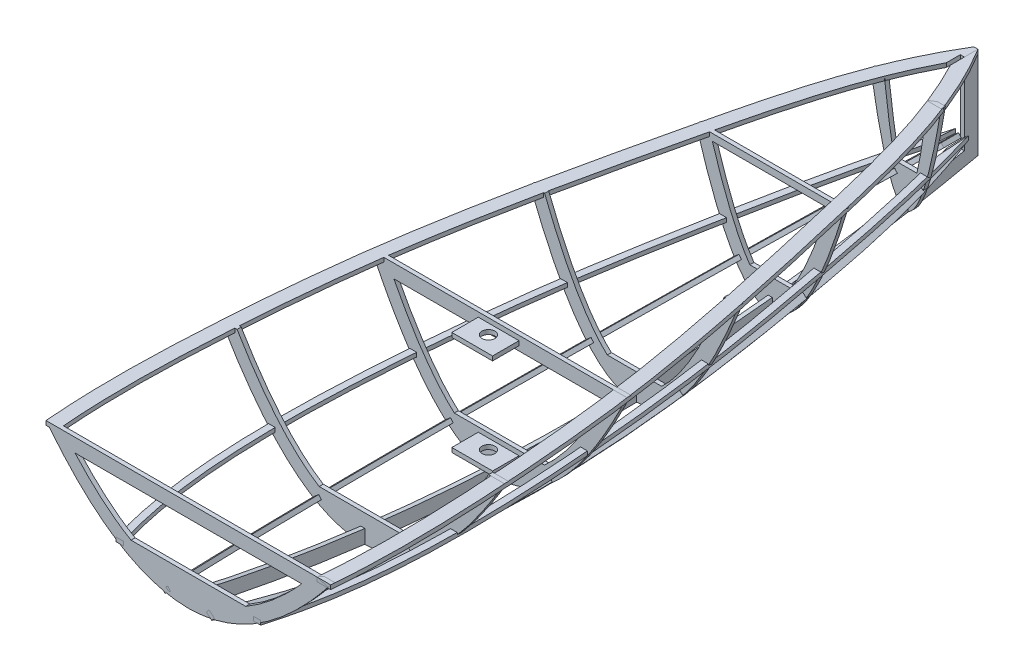
from build123d import *

# Parameters (mm, degrees)
BOSS_EXTRUDE1_DEPTH     = 1.51
BOSS_EXTRUDE2_DEPTH     = 1.51
BOSS_EXTRUDE3_START     = -1.51
BOSS_EXTRUDE3_DEPTH     = 3.02
BOSS_EXTRUDE4_START     = -3.02
BOSS_EXTRUDE4_DEPTH     = 3.02
BOSS_EXTRUDE5_START     = -1.51
BOSS_EXTRUDE5_OUTLINE_W = 30
BOSS_EXTRUDE5_OUTLINE_H = 3.2
BOSS_EXTRUDE5_DEPTH     = 3.02
BOSS_EXTRUDE6_DEPTH     = 1.51
BOSS_EXTRUDE7_DEPTH     = 1.51
BOSS_EXTRUDE8_DEPTH     = 1.51
BOSS_EXTRUDE11_DEPTH    = 1.6
BOSS_EXTRUDE9_DEPTH     = 3.02
SKETCH19_W              = 30
SKETCH19_H              = 22.5
SKETCH19_R              = 4.7625
BOSS_EXTRUDE12_DEPTH    = 3.2
BOSS_EXTRUDE13_START    = -73.370907
SKETCH19_2_W            = 30
SKETCH19_2_H            = 22.5
SKETCH19_2_R            = 4.7625
BOSS_EXTRUDE13_DEPTH    = 3.2


with BuildPart() as part:
    # Sketch12 → Boss-Extrude1 (new, symmetric)
    with BuildSketch(Plane(origin=(0, 0, 0), x_dir=(0, 0, -1), z_dir=(1, 0, 0))):
        with BuildLine():
            Line((-577.712135073, 42.420217283), (-579.999999592, 42.957911139))
            Line((-579.999999592, 42.957911139), (-579.999999592, 32.68545093))
            add(Edge.make_bspline(
                [(0, 32.145901014), (-49.525330781, 21.417396015), (-132.611366978, 7.429683457), (-249.881952902, -0.655976348), (-350.181116019, 0.094338407), (-460.668307849, 9.54780018), (-537.156578471, 22.616391283), (-579.999999592, 32.68545093)],
                knots=[0, 0, 0, 0, 0.260060421, 0.431503634, 0.602543052, 0.77418881, 1, 1, 1, 1], degree=3))
            Line((0, 32.145901014), (0, 42.377846539))
            Line((0, 42.377846539), (0, 100))
            Line((0, 100), (-10, 100))
            Line((-10, 100), (-10, 40.232191823))
            add(Edge.make_bspline(
                [(-10, 40.232191823), (-31.052581694, 35.782071128), (-75.990667051, 27.227393084), (-145.201305909, 17.437334137), (-217.502735798, 11.352979962), (-290.057427903, 9.323515679), (-362.585667071, 11.362235017), (-434.900780043, 17.513411459), (-506.835309141, 27.459676615), (-554.205734661, 36.895743708), (-577.712135073, 42.420217283)],
                knots=[0.013877421, 0.013877421, 0.013877421, 0.013877421, 0.125, 0.25, 0.375, 0.5, 0.625, 0.75, 0.875, 1, 1, 1, 1], degree=3))
        make_face()
    extrude(amount=BOSS_EXTRUDE1_DEPTH, both=True)


with BuildPart() as body_2:
    # Sketch13 → Boss-Extrude2 (new, symmetric)
    with BuildSketch(Plane(origin=(0, 50, 349.999999694), x_dir=(0, 0, -1), z_dir=(0.6427876096865381, 0.7660444431189791, 0))):
        with BuildLine():
            Line((339.743877836, -1.97092204), (327.028680724, -2.207358466))
            add(Edge.make_bspline(
                [(-228.638126642, -18.965520589), (-205.328000422, -25.564091644), (-169.71378297, -33.048286306), (-121.506682722, -39.379688009), (-73.01231088, -43.707584978), (-12.203336667, -45.868404467), (48.636352849, -44.036231472), (97.255668277, -40.66150775), (145.796442696, -36.203035302), (206.192712118, -28.441379937), (266.013860499, -17.275577293), (306.123232335, -7.743192742), (322.472206916, -3.440078745), (327.028680724, -2.207358466)],
                knots=[0, 0, 0, 0, 0.125, 0.1875, 0.25, 0.375, 0.5, 0.5625, 0.625, 0.75, 0.875, 0.9375, 0.961706413, 0.961706413, 0.961706413, 0.961706413], degree=3))
            Line((-228.638126642, -18.965520589), (-229.999999898, -18.580004982))
            Line((-229.999999898, -18.580004982), (-229.999999898, -23.776476963))
            add(Edge.make_bspline(
                [(-229.999999898, -23.776476963), (-187.624946823, -35.810765879), (-110.757346564, -47.307733367), (0.007380653, -52.092222889), (100.344733064, -46.361807952), (200.209241181, -34.219669393), (281.165485841, -22.017381692), (326.582041192, -8.953425301), (339.743877836, -4.478430193)],
                knots=[0, 0, 0, 0, 0.225071004, 0.395640197, 0.566277038, 0.737858903, 0.910958545, 0.981893873, 0.981893873, 0.981893873, 0.981893873], degree=3))
            Line((339.743877836, -4.478430193), (339.743877836, -1.97092204))
        make_face()
    extrude(amount=BOSS_EXTRUDE2_DEPTH, both=True)


with BuildPart() as body_3:
    # Mirror2: mirrored copy
    add(body_2.part.mirror(Plane(origin=(0, 0, 0), x_dir=(0, 0, 1), z_dir=(1, 0, 0))))


with BuildPart() as body_4:
    # Boss-Extrude3: read off the stored shape, not the designer's step
    # Boss-Extrude3 outline → Boss-Extrude3 (new body)
    with BuildSketch(Plane(origin=(0, 50, 0), x_dir=(1, 0, 0), z_dir=(0, 1, 0)).offset(BOSS_EXTRUDE3_START)):
        with BuildLine():
            Line((-47.957215706, -579.999999592), (-48.386027601, -578.56678991))
            add(Edge.make_bspline(
                [(-48.386027601, -578.56678991), (-51.780390578, -567.221947535), (-57.255740987, -544.144931603), (-62.14939856, -508.831952672), (-64.41246603, -473.037439636), (-64.759896634, -437.06816633), (-63.749399228, -401.171318806), (-61.60368121, -365.309028432), (-58.650503305, -329.474788162), (-54.963833585, -293.729962155), (-50.458388492, -258.090690177), (-45.052882293, -222.571282312), (-38.912555662, -187.119022753), (-30.051072715, -139.897301168), (-19.808313073, -88.535773063), (-10.325579957, -49.434915702), (-6.109558895, -33.694313911)],
                knots=[0.018209111, 0.018209111, 0.018209111, 0.018209111, 0.079571041, 0.140932972, 0.202294903, 0.263656833, 0.325018764, 0.386380694, 0.447742625, 0.509104555, 0.570466486, 0.631828417, 0.693190347, 0.754552278, 0.877276139, 0.960875362, 0.960875362, 0.960875362, 0.960875362], degree=3))
            Line((-6.109558895, -33.694313911), (-4.729698326, -10.256121858))
            add(Edge.make_bspline(
                [(-4.729698326, -10.256121858), (-8.59723264, -23.432288644), (-21.03171572, -69.608062913), (-37.295053486, -149.666311038), (-55.346205502, -249.581342159), (-66.234910476, -349.71161378), (-72.032198264, -460.286609496), (-65.753581713, -537.962915804), (-53.176216533, -579.999999592)],
                knots=[0.018209111, 0.018209111, 0.018209111, 0.018209111, 0.088278964, 0.262319454, 0.434981474, 0.606296405, 0.776566769, 1, 1, 1, 1], degree=3))
            Line((-53.176216533, -579.999999592), (-47.957215706, -579.999999592))
        make_face()
    extrude(amount=BOSS_EXTRUDE3_DEPTH)


with BuildPart() as body_5:
    # Mirror3: mirrored copy
    add(body_4.part.mirror(Plane(origin=(0, 0, 0), x_dir=(0, 0, 1), z_dir=(1, 0, 0))))


with BuildPart() as body_6:
    # Boss-Extrude4: read off the stored shape, not the designer's step
    # Boss-Extrude4 outline → Boss-Extrude4 (new body)
    with BuildSketch(Plane(origin=(0, 100, 0), x_dir=(1, 0, 0), z_dir=(0, 1, 0)).offset(BOSS_EXTRUDE4_START)):
        with BuildLine():
            add(Edge.make_bspline(
                [(1.51, 0), (29.584376395, -45.91990858), (50.561731734, -131.537674374), (77.549983497, -249.48960785), (95.891946939, -349.466899638), (105.994111445, -459.74489833), (108.450715428, -536.753852141), (104.849487474, -579.999999592)],
                knots=[0, 0, 0, 0, 0.268699023, 0.441133859, 0.611992394, 0.781089211, 1, 1, 1, 1], degree=3))
            Line((1.51, 0), (1.51, -20.242310976))
            add(Edge.make_bspline(
                [(1.51, -20.242310976), (1.624154147, -20.45928607), (4.52435319, -25.989273244), (12.437759947, -42.379794316), (23.206065428, -70.462042429), (33.548075871, -105.49899509), (40.887847408, -135.419484837), (46.556412593, -159.558389269), (52.169819755, -183.656511356), (58.999093392, -213.74858749), (66.769506371, -249.891743153), (73.974014335, -286.144876799), (80.384277047, -322.497100308), (85.741554413, -358.920589589), (89.905116159, -395.520906247), (93.082025729, -432.287571962), (95.515998483, -469.207045664), (97.044272034, -506.022429463), (97.118154571, -542.712791999), (95.894970795, -567.031140248), (94.883979989, -579.170143842)],
                knots=[0.029973022, 0.029973022, 0.029973022, 0.029973022, 0.03125, 0.0625, 0.125, 0.1875, 0.25, 0.28125, 0.3125, 0.375, 0.4375, 0.5, 0.5625, 0.625, 0.6875, 0.75, 0.8125, 0.875, 0.9375, 1, 1, 1, 1], degree=3))
            Line((94.883979989, -579.170143842), (94.814875574, -579.999999592))
            Line((94.814875574, -579.999999592), (104.849487474, -579.999999592))
        make_face()
    boss_extrude4 = extrude(amount=BOSS_EXTRUDE4_DEPTH)


with BuildPart() as body_7:
    # Boss-Extrude5: read off the stored shape, not the designer's step
    # Boss-Extrude5 outline → Boss-Extrude5 (new body)
    with BuildSketch(Plane.XY.offset(349.999999694).offset(BOSS_EXTRUDE5_START)):
        with BuildLine():
            add(Edge.make_bspline(
                [(-93.277863778, 100), (0.577718303, -97.223102138), (94.433300385, 100)],
                knots=[0.082951726, 0.082951726, 0.082951726, 0.917048274, 0.917048274, 0.917048274], degree=2))
            Line((94.433300385, 100), (-93.277863778, 100))
        make_face()
        with Locations((0, 21.629092809)):
            Rectangle(BOSS_EXTRUDE5_OUTLINE_W, BOSS_EXTRUDE5_OUTLINE_H, mode=Mode.SUBTRACT)
        with BuildLine():
            add(Edge.make_bspline(
                [(-77.172551795, 89.99999997), (-75.488371498, 86.733086903), (-71.765938198, 79.72797637), (-66.026158874, 69.661419231), (-59.962827418, 59.878586103), (-51.936080058, 48.054282871), (-43.737145318, 37.712907061), (-36.690709516, 30.37329819), (-33.564037303, 27.474408803), (-32.616641803, 26.629092809)],
                knots=[0.115020129, 0.115020129, 0.115020129, 0.115020129, 0.137965175, 0.165814007, 0.19366284, 0.221511673, 0.277209338, 0.308992768, 0.322917184, 0.322917184, 0.322917184, 0.322917184], degree=3))
            Line((-77.172551795, 89.99999997), (78.327988402, 89.99999997))
            add(Edge.make_bspline(
                [(33.77207841, 26.629092809), (34.71947391, 27.474408803), (37.846146121, 30.373298189), (44.892581923, 37.712907058), (53.091516662, 48.054282867), (61.118264022, 59.878586098), (67.181595477, 69.661419226), (72.921374803, 79.727976366), (76.643808104, 86.733086901), (78.327988402, 89.99999997)],
                knots=[0.677082816, 0.677082816, 0.677082816, 0.677082816, 0.691007232, 0.722790662, 0.778488327, 0.80633716, 0.834185993, 0.862034825, 0.884979871, 0.884979871, 0.884979871, 0.884979871], degree=3))
            Line((33.77207841, 26.629092809), (-32.616641803, 26.629092809))
        make_face(mode=Mode.SUBTRACT)
        with Locations((0, 95)):
            Rectangle(BOSS_EXTRUDE5_OUTLINE_W, BOSS_EXTRUDE5_OUTLINE_H, mode=Mode.SUBTRACT)
    extrude(amount=BOSS_EXTRUDE5_DEPTH)

    # Sketch19 → Boss-Extrude12 (add)
    with BuildSketch(Plane(origin=(0, 93.4, 0), x_dir=(1, 0, 0), z_dir=(0, 1, 0))):
        with Locations((0, -359.739999694)):
            Rectangle(SKETCH19_W, SKETCH19_H)
        with Locations(Location((0, -359.009999694, 0), (0, 0, 270))):
            Circle(SKETCH19_R, mode=Mode.SUBTRACT)
    extrude(amount=BOSS_EXTRUDE12_DEPTH)

    # Sketch19<2> → Boss-Extrude13 (add)
    with BuildSketch(Plane(origin=(0, 93.4, 0), x_dir=(1, 0, 0), z_dir=(0, 1, 0)).offset(BOSS_EXTRUDE13_START)):
        with Locations((0, -359.739999694)):
            Rectangle(SKETCH19_2_W, SKETCH19_2_H)
        with Locations(Location((0, -359.009999694, 0), (0, 0, 270))):
            Circle(SKETCH19_2_R, mode=Mode.SUBTRACT)
    extrude(amount=BOSS_EXTRUDE13_DEPTH)


with BuildPart() as body_8:
    # Sketch3 → Boss-Extrude6 (new, symmetric)
    with BuildSketch(Plane.XY.offset(249.999999796)):
        with BuildLine():
            Line((-66.164994966, 100), (-76.900421758, 100))
            add(Edge.make_bspline(
                [(-76.900421758, 100), (1e-09, -98.768944841), (76.900421759, 100)],
                knots=[0.153970677, 0.153970677, 0.153970677, 0.846029323, 0.846029323, 0.846029323], degree=2))
            Line((76.900421759, 100), (66.164994967, 100))
            add(Edge.make_bspline(
                [(19.977750638, 20), (20.874930157, 20.803647876), (24.031714806, 23.79470676), (31.075637964, 31.736923077), (41.367334507, 46.838876846), (51.443490399, 65.874869121), (59.58308283, 83.831283466), (63.820493927, 94.069554672), (66.017237824, 99.625197236), (66.164994967, 100)],
                knots=[0.619916665, 0.619916665, 0.619916665, 0.619916665, 0.633981515, 0.668778193, 0.72503759, 0.781296988, 0.809426687, 0.837556386, 0.839584601, 0.839584601, 0.839584601, 0.839584601], degree=3))
            Line((19.977750638, 20), (-19.977750637, 20))
            add(Edge.make_bspline(
                [(-66.164994966, 100), (-66.017237823, 99.625197237), (-63.820493927, 94.069554674), (-59.58308283, 83.831283469), (-51.443490399, 65.874869124), (-41.367334507, 46.838876848), (-31.075637963, 31.736923078), (-24.031714806, 23.794706761), (-20.874930156, 20.803647876), (-19.977750637, 20)],
                knots=[0.160415399, 0.160415399, 0.160415399, 0.160415399, 0.162443614, 0.190573313, 0.218703012, 0.27496241, 0.331221807, 0.366018485, 0.380083335, 0.380083335, 0.380083335, 0.380083335], degree=3))
        make_face()
    extrude(amount=BOSS_EXTRUDE6_DEPTH, both=True)


with BuildPart() as body_9:
    # Sketch2 → Boss-Extrude7 (new, symmetric)
    with BuildSketch(Plane.XY.offset(149.999999898)):
        with BuildLine():
            Line((-44.141104322, 100), (-54.574057855, 100))
            add(Edge.make_bspline(
                [(-54.574057855, 100), (0, -84.930942065), (54.574057856, 100)],
                knots=[0.252174693, 0.252174693, 0.252174693, 0.747825307, 0.747825307, 0.747825307], degree=2))
            Line((54.574057856, 100), (44.141104323, 100))
            add(Edge.make_bspline(
                [(42.620280244, 94.999999998), (43.126908761, 96.641318282), (43.633855992, 98.307997269), (44.141104323, 100)],
                knots=[0.736932967, 0.736932967, 0.736932967, 0.736932967, 0.743946627, 0.743946627, 0.743946627, 0.743946627], degree=3))
            add(Edge.make_bspline(
                [(15.021850494, 30), (15.482688715, 30.665037197), (16.412555161, 32.051495373), (18.826789615, 35.886481746), (22.755228229, 42.901269605), (29.970392448, 58.277568708), (36.273369316, 75.189483004), (41.084126126, 90.073085786), (42.108011639, 93.340409589), (42.620280244, 94.999999998)],
                knots=[0.60554065, 0.60554065, 0.60554065, 0.60554065, 0.61263239, 0.61972413, 0.641834804, 0.670201764, 0.722749487, 0.729841227, 0.736932967, 0.736932967, 0.736932967, 0.736932967], degree=3))
            add(Edge.make_bspline(
                [(-15.021850493, 30), (-14.561012272, 29.334962803), (-13.244589919, 27.499451376), (-10.196217795, 23.67845612), (-6.17905019, 19.852352844), (-3.039104367, 18.127433877), (-1.185298275, 17.607875327), (2e-09, 17.497855788), (1.185298279, 17.607875328), (3.039104372, 18.127433879), (6.179050196, 19.852352848), (10.196217799, 23.678456125), (13.244589922, 27.499451379), (14.561012273, 29.334962803), (15.021850494, 30)],
                knots=[0.39445935, 0.39445935, 0.39445935, 0.39445935, 0.40155109, 0.414899118, 0.443266079, 0.471633039, 0.48581652, 0.5, 0.51418348, 0.528366961, 0.556733921, 0.585100882, 0.59844891, 0.60554065, 0.60554065, 0.60554065, 0.60554065], degree=3))
            add(Edge.make_bspline(
                [(-42.620280243, 94.999999998), (-42.108011638, 93.340409589), (-41.084126125, 90.073085786), (-36.273369313, 75.189482996), (-29.970392442, 58.277568696), (-22.755228223, 42.901269596), (-18.826789612, 35.886481743), (-16.41255516, 32.051495373), (-15.482688714, 30.665037197), (-15.021850493, 30)],
                knots=[0.263067033, 0.263067033, 0.263067033, 0.263067033, 0.270158773, 0.277250513, 0.329798236, 0.358165196, 0.38027587, 0.38736761, 0.39445935, 0.39445935, 0.39445935, 0.39445935], degree=3))
            add(Edge.make_bspline(
                [(-44.141104322, 100), (-43.633855991, 98.307997269), (-43.126908761, 96.641318282), (-42.620280243, 94.999999998)],
                knots=[0.256053373, 0.256053373, 0.256053373, 0.256053373, 0.263067033, 0.263067033, 0.263067033, 0.263067033], degree=3))
        make_face()
        with BuildLine():
            Line((44.141104323, 100), (-44.141104322, 100))
            add(Edge.make_bspline(
                [(-44.141104322, 100), (-43.633855991, 98.307997269), (-43.126908761, 96.641318282), (-42.620280243, 94.999999998)],
                knots=[0.256053373, 0.256053373, 0.256053373, 0.256053373, 0.263067033, 0.263067033, 0.263067033, 0.263067033], degree=3))
            Line((-42.620280243, 94.999999998), (42.620280244, 94.999999998))
            add(Edge.make_bspline(
                [(42.620280244, 94.999999998), (43.126908761, 96.641318282), (43.633855992, 98.307997269), (44.141104323, 100)],
                knots=[0.736932967, 0.736932967, 0.736932967, 0.736932967, 0.743946627, 0.743946627, 0.743946627, 0.743946627], degree=3))
        make_face()
        with BuildLine():
            Line((15.021850494, 30), (-15.021850493, 30))
            add(Edge.make_bspline(
                [(-15.021850493, 30), (-14.561012272, 29.334962803), (-13.244589919, 27.499451376), (-10.196217795, 23.67845612), (-6.17905019, 19.852352844), (-3.039104367, 18.127433877), (-1.185298275, 17.607875327), (2e-09, 17.497855788), (1.185298279, 17.607875328), (3.039104372, 18.127433879), (6.179050196, 19.852352848), (10.196217799, 23.678456125), (13.244589922, 27.499451379), (14.561012273, 29.334962803), (15.021850494, 30)],
                knots=[0.39445935, 0.39445935, 0.39445935, 0.39445935, 0.40155109, 0.414899118, 0.443266079, 0.471633039, 0.48581652, 0.5, 0.51418348, 0.528366961, 0.556733921, 0.585100882, 0.59844891, 0.60554065, 0.60554065, 0.60554065, 0.60554065], degree=3))
        make_face()
    extrude(amount=BOSS_EXTRUDE7_DEPTH, both=True)


with BuildPart() as body_10:
    # Sketch5 → Boss-Extrude8 (new, symmetric)
    with BuildSketch(Plane.XY.offset(449.999999592)):
        with BuildLine():
            Line((-92.635192534, 100), (-104.2281432, 100))
            add(Edge.make_bspline(
                [(-104.2281432, 100), (0, -80.296453814), (104.228143201, 100)],
                knots=[0.080849136, 0.080849136, 0.080849136, 0.919150864, 0.919150864, 0.919150864], degree=2))
            Line((104.228143201, 100), (92.635192535, 100))
            add(Edge.make_bspline(
                [(32.198062586, 30), (33.22805556, 30.64069364), (35.296942023, 31.986417641), (40.619588122, 35.752691583), (49.206844806, 42.826314426), (59.064391632, 52.943653391), (67.837657089, 63.458838359), (74.463600532, 72.156882854), (81.127599779, 81.665959915), (86.707115174, 90.26465744), (90.547630011, 96.512596453), (92.151577539, 99.187511767), (92.635192535, 100)],
                knots=[0.650724667, 0.650724667, 0.650724667, 0.650724667, 0.664556376, 0.678388086, 0.72130735, 0.776634188, 0.804297606, 0.831961025, 0.859624444, 0.887287863, 0.901119572, 0.907086872, 0.907086872, 0.907086872, 0.907086872], degree=3))
            add(Edge.make_bspline(
                [(-32.198062586, 30), (-31.168069612, 29.35930636), (-28.197033065, 27.596385304), (-21.215677113, 24.033549171), (-11.476442878, 20.718171411), (0, 19.418573934), (11.476442878, 20.71817141), (21.215677113, 24.033549171), (28.197033066, 27.596385304), (31.168069613, 29.35930636), (32.198062586, 30)],
                knots=[0.349275333, 0.349275333, 0.349275333, 0.349275333, 0.363107042, 0.389346325, 0.444673162, 0.5, 0.555326837, 0.610653675, 0.636892958, 0.650724667, 0.650724667, 0.650724667, 0.650724667], degree=3))
            add(Edge.make_bspline(
                [(-92.635192534, 100), (-92.151577539, 99.187511768), (-90.547630011, 96.512596455), (-86.707115174, 90.264657442), (-81.12759978, 81.665959917), (-74.463600532, 72.156882855), (-67.83765709, 63.458838361), (-59.064391633, 52.943653392), (-49.206844806, 42.826314426), (-40.619588121, 35.752691584), (-35.296942022, 31.986417641), (-33.228055559, 30.64069364), (-32.198062586, 30)],
                knots=[0.092913128, 0.092913128, 0.092913128, 0.092913128, 0.098880428, 0.112712137, 0.140375556, 0.168038975, 0.195702394, 0.223365812, 0.27869265, 0.321611914, 0.335443624, 0.349275333, 0.349275333, 0.349275333, 0.349275333], degree=3))
        make_face()
        with BuildLine():
            Line((32.198062586, 30), (-32.198062586, 30))
            add(Edge.make_bspline(
                [(-32.198062586, 30), (-31.168069612, 29.35930636), (-28.197033065, 27.596385304), (-21.215677113, 24.033549171), (-11.476442878, 20.718171411), (0, 19.418573934), (11.476442878, 20.71817141), (21.215677113, 24.033549171), (28.197033066, 27.596385304), (31.168069613, 29.35930636), (32.198062586, 30)],
                knots=[0.349275333, 0.349275333, 0.349275333, 0.349275333, 0.363107042, 0.389346325, 0.444673162, 0.5, 0.555326837, 0.610653675, 0.636892958, 0.650724667, 0.650724667, 0.650724667, 0.650724667], degree=3))
        make_face()
    extrude(amount=BOSS_EXTRUDE8_DEPTH, both=True)


with BuildPart() as body_11:
    # Sketch1 → Boss-Extrude11 (new, symmetric)
    with BuildSketch(Plane.XY.offset(50)):
        with BuildLine():
            Line((-25.909294324, 100), (-15.909294324, 100))
            add(Edge.make_bspline(
                [(-15.909294324, 100), (-12.034369694, 66.950295677), (-8.159445002, 50)],
                knots=[0, 0, 0, 0.243563581, 0.243563581, 0.243563581], degree=2))
            Line((-8.159445002, 50), (8.15944517, 50))
            add(Edge.make_bspline(
                [(8.15944517, 50), (12.034369995, 66.950295677), (15.909294882, 100)],
                knots=[0.756436419, 0.756436419, 0.756436419, 1, 1, 1], degree=2))
            Line((15.909294882, 100), (25.909294882, 100))
            add(Edge.make_bspline(
                [(-25.909294324, 100), (7e-09, -55.692307691), (25.909294882, 100)],
                knots=[0.381844088, 0.381844088, 0.381844088, 0.618155912, 0.618155912, 0.618155912], degree=2))
        make_face()
    extrude(amount=BOSS_EXTRUDE11_DEPTH, both=True)


with BuildPart() as body_12:
    # Sketch8 → Boss-Extrude9 (new body)
    with BuildSketch(Plane.XY.offset(579.999999592)):
        with BuildLine():
            Line((-92.056458663, 100), (-104.849487474, 100))
            add(Edge.make_bspline(
                [(-104.849487474, 100), (0, -34.62909814), (104.849487474, 100)],
                knots=[0.082903375, 0.082903375, 0.082903375, 0.917096625, 0.917096625, 0.917096625], degree=2))
            Line((104.849487474, 100), (92.056458663, 100))
            add(Edge.make_bspline(
                [(83.494275635, 90), (83.770271022, 90.307353245), (85.47782842, 92.217901018), (88.294901357, 95.461462094), (90.876087017, 98.558154343), (92.021479083, 99.95724926), (92.056458663, 100)],
                knots=[0.861742912, 0.861742912, 0.861742912, 0.861742912, 0.86516155, 0.882887424, 0.896561974, 0.896992724, 0.896992724, 0.896992724, 0.896992724], degree=3))
            add(Edge.make_bspline(
                [(42.222223482, 55), (43.277036635, 55.610084271), (45.667248268, 57.042721147), (52.32111389, 61.347315459), (60.127722722, 67.257462391), (68.823136561, 74.943303669), (75.335959735, 81.248365865), (79.959976387, 86.109764089), (82.666453343, 89.081027253), (83.218280248, 89.692646755), (83.494275635, 90)],
                knots=[0.687879044, 0.687879044, 0.687879044, 0.687879044, 0.701553595, 0.718792813, 0.773491017, 0.800840119, 0.82818922, 0.854905637, 0.858324274, 0.861742912, 0.861742912, 0.861742912, 0.861742912], degree=3))
            add(Edge.make_bspline(
                [(-42.222223482, 55), (-41.167410329, 54.389915729), (-39.062753998, 53.217018132), (-33.052204526, 50.120429946), (-24.005867253, 46.368429369), (-12.066510087, 43.360664675), (0, 42.347844058), (12.066510087, 43.360664675), (24.005867253, 46.368429369), (33.052204526, 50.120429946), (39.062753998, 53.217018132), (41.167410329, 54.389915729), (42.222223482, 55)],
                knots=[0.312120956, 0.312120956, 0.312120956, 0.312120956, 0.325795506, 0.339470057, 0.390603593, 0.445301797, 0.5, 0.554698203, 0.609396407, 0.660529943, 0.674204494, 0.687879044, 0.687879044, 0.687879044, 0.687879044], degree=3))
            add(Edge.make_bspline(
                [(-83.494275635, 90), (-83.218280248, 89.692646755), (-82.666453343, 89.081027253), (-79.959976387, 86.109764089), (-75.335959735, 81.248365865), (-68.823136562, 74.943303669), (-60.127722722, 67.257462391), (-52.32111389, 61.347315459), (-45.667248268, 57.042721147), (-43.277036635, 55.610084271), (-42.222223482, 55)],
                knots=[0.138257088, 0.138257088, 0.138257088, 0.138257088, 0.141675726, 0.145094363, 0.17181078, 0.199159881, 0.226508983, 0.281207187, 0.298446405, 0.312120956, 0.312120956, 0.312120956, 0.312120956], degree=3))
            add(Edge.make_bspline(
                [(-92.056458663, 100), (-92.021479083, 99.95724926), (-90.876087017, 98.558154343), (-88.294901357, 95.461462094), (-85.47782842, 92.217901018), (-83.770271022, 90.307353245), (-83.494275635, 90)],
                knots=[0.103007276, 0.103007276, 0.103007276, 0.103007276, 0.103438026, 0.117112576, 0.13483845, 0.138257088, 0.138257088, 0.138257088, 0.138257088], degree=3))
        make_face()
        with BuildLine():
            Line((92.056458663, 100), (-92.056458663, 100))
            add(Edge.make_bspline(
                [(-92.056458663, 100), (-92.021479083, 99.95724926), (-90.876087017, 98.558154343), (-88.294901357, 95.461462094), (-85.47782842, 92.217901018), (-83.770271022, 90.307353245), (-83.494275635, 90)],
                knots=[0.103007276, 0.103007276, 0.103007276, 0.103007276, 0.103438026, 0.117112576, 0.13483845, 0.138257088, 0.138257088, 0.138257088, 0.138257088], degree=3))
            Line((-83.494275635, 90), (83.494275635, 90))
            add(Edge.make_bspline(
                [(83.494275635, 90), (83.770271022, 90.307353245), (85.47782842, 92.217901018), (88.294901357, 95.461462094), (90.876087017, 98.558154343), (92.021479083, 99.95724926), (92.056458663, 100)],
                knots=[0.861742912, 0.861742912, 0.861742912, 0.861742912, 0.86516155, 0.882887424, 0.896561974, 0.896992724, 0.896992724, 0.896992724, 0.896992724], degree=3))
        make_face()
        with BuildLine():
            Line((42.222223482, 55), (-42.222223482, 55))
            add(Edge.make_bspline(
                [(-42.222223482, 55), (-41.167410329, 54.389915729), (-39.062753998, 53.217018132), (-33.052204526, 50.120429946), (-24.005867253, 46.368429369), (-12.066510087, 43.360664675), (0, 42.347844058), (12.066510087, 43.360664675), (24.005867253, 46.368429369), (33.052204526, 50.120429946), (39.062753998, 53.217018132), (41.167410329, 54.389915729), (42.222223482, 55)],
                knots=[0.312120956, 0.312120956, 0.312120956, 0.312120956, 0.325795506, 0.339470057, 0.390603593, 0.445301797, 0.5, 0.554698203, 0.609396407, 0.660529943, 0.674204494, 0.687879044, 0.687879044, 0.687879044, 0.687879044], degree=3))
        make_face()
    extrude(amount=-BOSS_EXTRUDE9_DEPTH)


with BuildPart() as part_1:
    add(part.part)

    add(body_7.part)  # Mirror5 merges body 7

    add(body_8.part)  # Mirror5 merges body 8

    add(body_9.part)  # Mirror5 merges body 9

    add(body_10.part)  # Mirror5 merges body 10

    add(body_11.part)  # Mirror5 merges body 11

    add(body_12.part)  # Mirror5 merges body 12
    # Mirror5: Boss-Extrude4 across plane
    add(boss_extrude4.mirror(Plane(origin=(0, 0, 0), x_dir=(0, 0, 1), z_dir=(1, 0, 0))))


solid = Compound([body_2.part, body_3.part, body_4.part, body_5.part, body_6.part, part_1.part])
